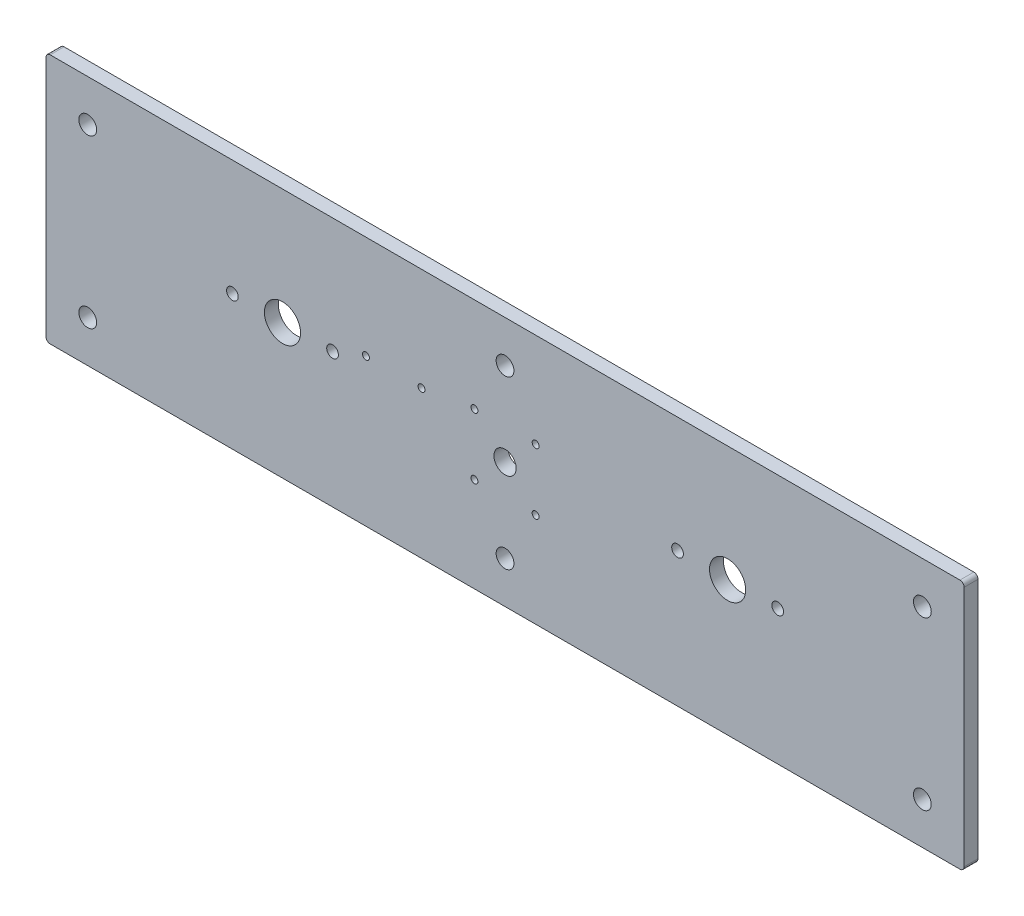
from build123d import *

# Parameters (mm, degrees)
SKETCH1_W                = 330
SKETCH1_H                = 90
BOSS_EXTRUDE1_DEPTH      = 2.5
M6_CLEARANCE_HOLE1_D     = 6.4
M6_CLEARANCE_HOLE1_DEPTH = 10
M6_CLEARANCE_HOLE1_TIP   = 1.922753981
SKETCH3_R                = 6.5
CUT_EXTRUDE2_DEPTH       = 172.099386323
M5X0_8_TAPPED_HOLE1_D    = 4.2
SKETCH4_R                = 4
CUT_EXTRUDE3_DEPTH       = 172.099386323
M3X0_5_TAPPED_HOLE1_D    = 2.5
FILLET1_R                = 1.5
M3X0_5_TAPPED_HOLE2_D    = 2.5


with BuildPart() as part:
    # Sketch1 → Boss-Extrude1 (new, symmetric)
    with BuildSketch(Plane.XY):
        Rectangle(SKETCH1_W, SKETCH1_H)
    extrude(amount=BOSS_EXTRUDE1_DEPTH, both=True)

    # M6 Clearance Hole1
    with Locations(Plane.XY.offset(2.5)):
        with Locations((-150, 30), (-150, -30), (0, 30), (0, -30), (150, -30), (150, 30)):
            Hole(M6_CLEARANCE_HOLE1_D / 2, depth=M6_CLEARANCE_HOLE1_DEPTH)
            with Locations((0, 0, -(M6_CLEARANCE_HOLE1_DEPTH + M6_CLEARANCE_HOLE1_TIP / 2))):  # 118° drill point
                Cone(0, M6_CLEARANCE_HOLE1_D / 2, M6_CLEARANCE_HOLE1_TIP, mode=Mode.SUBTRACT)

    # Sketch3 → Cut-Extrude2 (cut, through all)
    with BuildSketch(Plane.XY.offset(2.5)):
        with Locations((-80, 3.4)):
            Circle(SKETCH3_R)
    cut_extrude2 = extrude(amount=-CUT_EXTRUDE2_DEPTH, mode=Mode.SUBTRACT)

    # M5x0.8 Tapped Hole1 (through all)
    with Locations(Plane.XY.offset(2.5)):
        with Locations((-98, 3.4), (-62, 3.4)):
            m5x0_8_tapped_hole1 = Hole(M5X0_8_TAPPED_HOLE1_D / 2)

    # Mirror1: Cut-Extrude2, M5x0.8 Tapped Hole1 across plane
    add(cut_extrude2.mirror(Plane(origin=(0, 0, 0), x_dir=(0, 0, 1), z_dir=(1, 0, 0))), mode=Mode.SUBTRACT)
    add(m5x0_8_tapped_hole1.mirror(Plane(origin=(0, 0, 0), x_dir=(0, 0, 1), z_dir=(1, 0, 0))), mode=Mode.SUBTRACT)

    # Sketch4 → Cut-Extrude3 (cut, through all)
    with BuildSketch(Plane.XY.offset(2.5)):
        Circle(SKETCH4_R)
    extrude(amount=-CUT_EXTRUDE3_DEPTH, mode=Mode.SUBTRACT)

    # M3x0.5 Tapped Hole1 (through all)
    with Locations(Plane.XY.offset(2.5)):
        with Locations((11, 11), (-11, -11), (-11, 11), (11, -11)):
            Hole(M3X0_5_TAPPED_HOLE1_D / 2)

    # Fillet1
    fillet1_edges = [part.edges().sort_by_distance(p)[0] for p in [
        (-165, -45, 0),
        (-165, 45, 0),
        (165, -45, 0),
        (165, 45, 0),
    ]]
    fillet(fillet1_edges, radius=FILLET1_R)

    # M3x0.5 Tapped Hole2 (through all)
    with Locations(Plane.XY.offset(2.5)):
        with Locations((-30, 8), (-50, 8)):
            Hole(M3X0_5_TAPPED_HOLE2_D / 2)


solid = part.part
